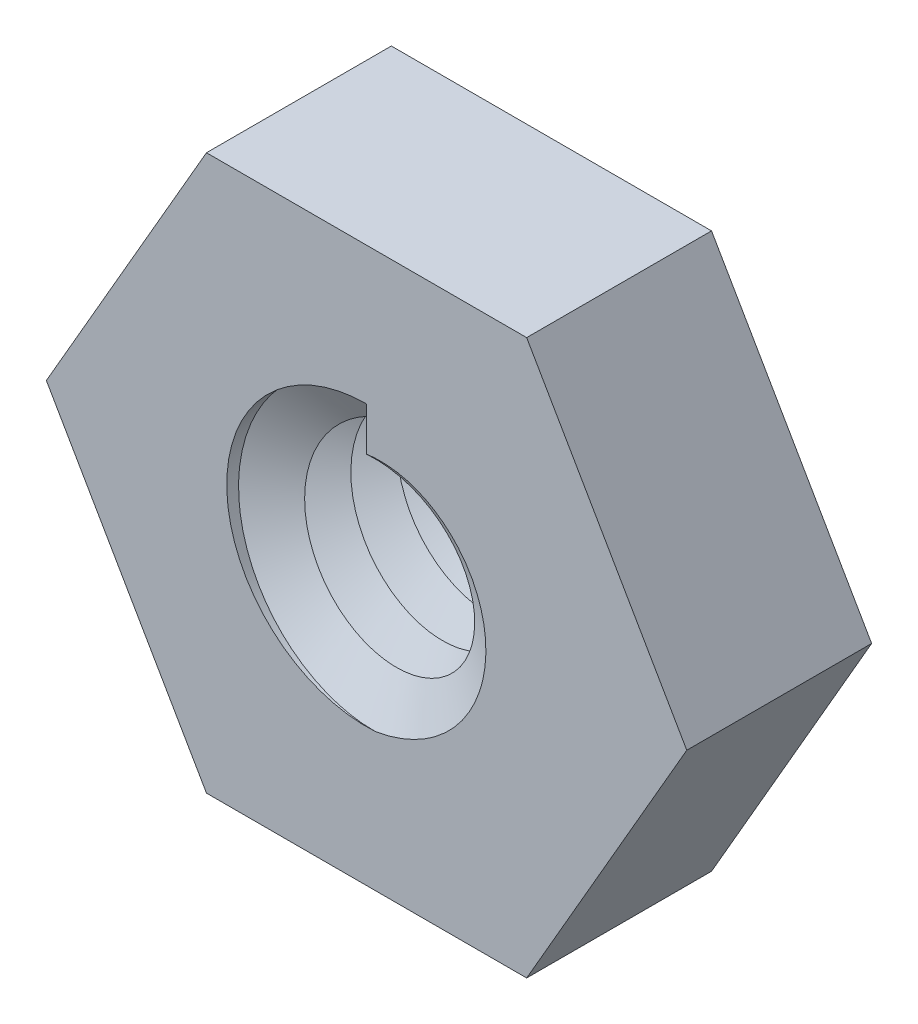
from build123d import *

# Parameters (mm, degrees)
ESBO_O1_R                = 6.05
RESSALTO_EXTRUS_O1_DEPTH = 8
VARREDURA1_PITCH         = 2
ESBO_O4_W                = 17.42219214
ESBO_O4_H                = 5.356209197
ESBO_O4_W_2              = 16.6512052
ESBO_O4_H_2              = 9.002412072
CORTE_EXTRUS_O1_DEPTH    = 25


with BuildPart() as part:
    # Esboço1 → Ressalto-extrusão1 (new body)
    with BuildSketch(Plane.XY):
        Polygon((-13.856406461, 0), (-6.92820323, -12), (6.92820323, -12), (13.856406461, 0), (6.92820323, 12), (-6.92820323, 12), align=None)
        Circle(ESBO_O1_R, mode=Mode.SUBTRACT)
    extrude(amount=RESSALTO_EXTRUS_O1_DEPTH)

    # Varredura1: arcs per turn and ends read off the stored shape
    # Varredura1: the profile of Esboço3 screwed along a right-hand helix through 5.25 turns, 10 arcs to a turn; built about Z, then put on its axis
    varredura1_z = Axis((0, 0, 0), (0, 0, 1))
    varredura1_corners = [(6.05, 0, 0), (6.05, 0, -0.98), (4.167437516, 0, 0), (6.05, 0, 0.98)]
    with BuildLine(mode=Mode.PRIVATE) as varredura1_profile:
        Line(varredura1_corners[0], varredura1_corners[1])
        Line(varredura1_corners[1], varredura1_corners[2])
        Line(varredura1_corners[2], varredura1_corners[3])
        Line(varredura1_corners[3], varredura1_corners[0])
    varredura1_cap = Face(varredura1_profile.wire())
    varredura1_turn_angles = [0, 18, 36, 54, 72, 90, 108, 126, 144, 162, 180, 198, 216, 234, 252, 270, 288, 306, 324, 342, 360]
    varredura1_turn_weights = [1, 0.9510565162951535, 1, 0.9510565162951535, 1, 0.9510565162951535, 1, 0.9510565162951535, 1, 0.9510565162951535, 1, 0.9510565162951535, 1, 0.9510565162951535, 1, 0.9510565162951535, 1, 0.9510565162951535, 1, 0.9510565162951535, 1]
    varredura1_turn_rails = [Edge.make_bspline([Vector(p[0], p[1], 0).rotate(varredura1_z, varredura1_turn_angles[k]) / varredura1_turn_weights[k] + Vector(0, 0, p[2] + VARREDURA1_PITCH * varredura1_turn_angles[k] / 360) for k in range(21)], [0, 0, 0, 1, 1, 2, 2, 3, 3, 4, 4, 5, 5, 6, 6, 7, 7, 8, 8, 9, 9, 10, 10, 10], 2, varredura1_turn_weights) for p in varredura1_corners]
    varredura1_turn_sides = [Face.make_surface_from_curves(varredura1_turn_rails[p[0]], varredura1_turn_rails[p[1]]) for p in [(0, 1), (1, 2), (2, 3), (3, 0)]]
    varredura1_last_angles = [1800, 1818, 1836, 1854, 1872, 1881, 1890]
    varredura1_last_weights = [1, 0.9510565162951535, 1, 0.9510565162951535, 1, 0.9876883405951316, 1]
    varredura1_last_rails = [Edge.make_bspline([Vector(p[0], p[1], 0).rotate(varredura1_z, varredura1_last_angles[k]) / varredura1_last_weights[k] + Vector(0, 0, p[2] + VARREDURA1_PITCH * varredura1_last_angles[k] / 360) for k in range(7)], [0, 0, 0, 1, 1, 2, 2, 3, 3, 3], 2, varredura1_last_weights) for p in varredura1_corners]
    varredura1_last_sides = [Face.make_surface_from_curves(varredura1_last_rails[p[0]], varredura1_last_rails[p[1]]) for p in [(0, 1), (1, 2), (2, 3), (3, 0)]]
    varredura1 = Plane(origin=(0, 0, 8), x_dir=(0, 1, 0), z_dir=(0, 0, -1)) * Solid(Shell([*[p.moved(Location((0, 0, VARREDURA1_PITCH * i))) for i in range(5) for p in varredura1_turn_sides], *varredura1_last_sides, varredura1_cap, varredura1_cap.rotate(varredura1_z, 1890).moved(Location((0, 0, VARREDURA1_PITCH * 1890 / 360)))]))
    add(varredura1)

    # Esboço4 → Corte-extrusão1 (cut)
    with BuildSketch(Plane.XZ.offset(12)):
        with Locations((1.78289284, 10.678104598)):
            Rectangle(ESBO_O4_W, ESBO_O4_H)
        with Locations((-1.39739937, -4.501206036)):
            Rectangle(ESBO_O4_W_2, ESBO_O4_H_2)
    extrude(amount=-CORTE_EXTRUS_O1_DEPTH, mode=Mode.SUBTRACT)


solid = part.part
